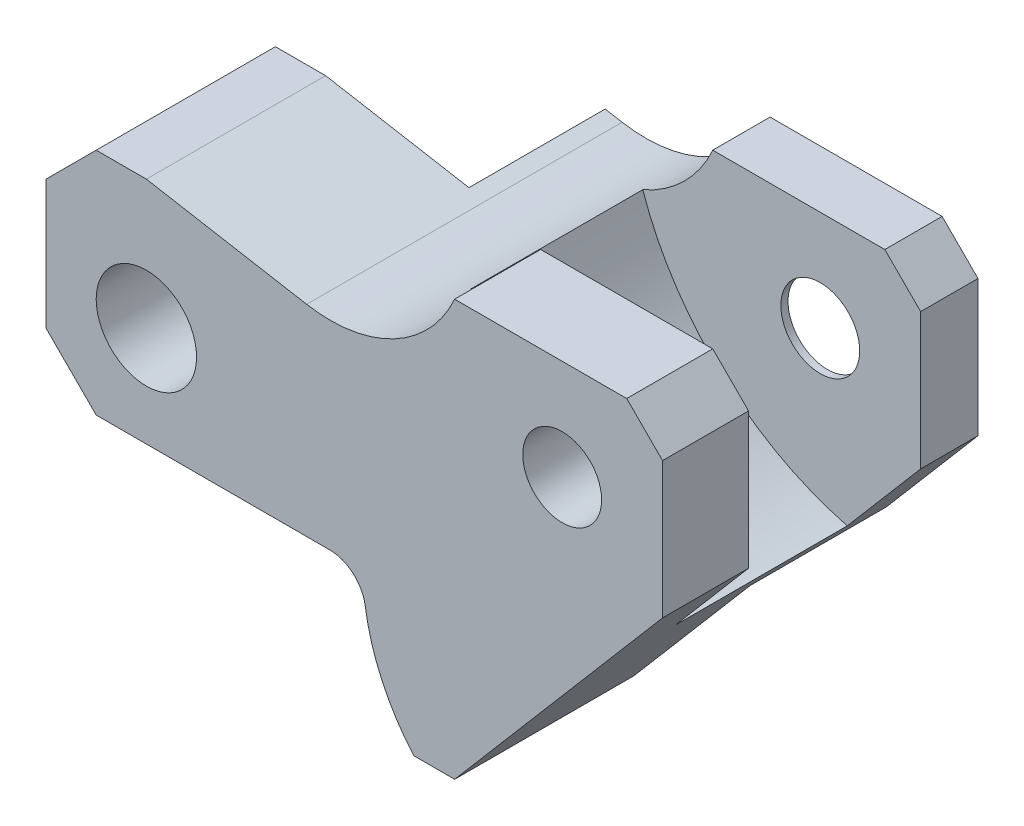
from build123d import *

# Parameters (mm, degrees)
ESQUISSE1_R             = 7
ESQUISSE1_R_2           = 5.5
BOSS_EXTRU_1_DEPTH      = 44
ENL_V_MAT_EXTRU_1_DEPTH = 19
ENL_V_MAT_EXTRU_2_DEPTH = 24
SHELL2_DEPTH            = 19
SHELL2_2_OUTLINE_R      = 6.5
SHELL2_2_DEPTH          = 7
SKETCH2_R               = 6.5
CUT_EXTRUDE1_DEPTH      = 7
CUT_EXTRUDE2_DEPTH      = 13


# Read off the part's stored shape, not the designer's step: Shell2
with BuildPart() as part:
    # Esquisse1 → Boss.-Extru.1 (new body)
    with BuildSketch(Plane.XY):
        with BuildLine():
            Line((-3.424461089, -10), (-36, -10))
            Line((-36, -10), (-43, -3))
            Line((-43, -3), (-43, 15))
            Line((-43, 15), (-36, 22))
            Line((-36, 22), (-29, 22))
            Line((-29, 22), (-6.638619164, 18.057085233))
            ThreePointArc((-6.638619164, 18.057085233), (5.561098706, 19.982044142), (14, 29))
            Line((14, 29), (38, 29))
            Line((38, 29), (43, 24))
            Line((43, 24), (43, 5))
            Line((43, 5), (14, -29))
            Line((14, -29), (8.296980053, -29))
            ThreePointArc((8.296980053, -29), (3.858007856, -22.115672061), (1.521177653, -14.264705882))
            ThreePointArc((1.521177653, -14.264705882), (-0.159225308, -11.213413768), (-3.424461089, -10))
        make_face()
        with Locations((-29, 4)):
            Circle(ESQUISSE1_R, mode=Mode.SUBTRACT)
        with Locations((29, 15)):
            Circle(ESQUISSE1_R_2, mode=Mode.SUBTRACT)
    extrude(amount=BOSS_EXTRU_1_DEPTH)

    # Esquisse4 → Enlèv. mat.-Extru.1 (cut)
    with BuildSketch(Plane(origin=(0, 0, 0), x_dir=(-1, 0, 0), z_dir=(0, 0, -1))):
        Polygon((9, 18.473460386), (9, -10), (36, -10), (43, -3), (43, 15), (36, 22), (29, 22), align=None)
        with BuildLine():
            Line((3.424461089, -10), (-30.205882353, -10))
            Line((-30.205882353, -10), (-14, -29))
            Line((-14, -29), (-8.296980053, -29))
            ThreePointArc((-8.296980053, -29), (-3.858007856, -22.115672061), (-1.521177653, -14.264705882))
            ThreePointArc((-1.521177653, -14.264705882), (0.159225308, -11.213413768), (3.424461089, -10))
        make_face()
    extrude(amount=-ENL_V_MAT_EXTRU_1_DEPTH, mode=Mode.SUBTRACT)

    # Esquisse5 → Enlèv. mat.-Extru.2 (cut)
    with BuildSketch(Plane.XY.offset(32)):
        with BuildLine():
            Line((2.167462324, 29), (38, 29))
            Line((38, 29), (43, 24))
            Line((43, 24), (43, 5))
            Line((43, 5), (32.764705882, -7))
            ThreePointArc((32.764705882, -7), (11.75930761, 6.149676936), (2.167462324, 29))
        make_face()
    extrude(amount=-ENL_V_MAT_EXTRU_2_DEPTH, mode=Mode.SUBTRACT)

    # Shell2 outline → Shell2 (cut)
    with BuildSketch(Plane.XY):
        with BuildLine():
            Line((-8, -9), (29.744476296, -9))
            Line((29.744476296, -9), (30.986847747, -7.543426575))
            ThreePointArc((30.986847747, -7.543426575), (14.310181683, 2.027872638), (3.646682943, 18.028208705))
            ThreePointArc((3.646682943, 18.028208705), (-1.518923584, 16.851449437), (-6.812267342, 17.07227748))
            Line((-6.812267342, 17.07227748), (-8, 17.281706793))
            Line((-8, 17.281706793), (-8, -9))
        make_face()
    extrude(amount=SHELL2_DEPTH, mode=Mode.SUBTRACT)

    # Shell2 2 outline → Shell2 2 (cut)
    with BuildSketch(Plane.XY):
        with BuildLine():
            ThreePointArc((3.646682943, 18.028208705), (14.310181683, 2.027872638), (30.986847747, -7.543426575))
            Line((30.986847747, -7.543426575), (42, 5.368545033))
            Line((42, 5.368545033), (42, 23.585786438))
            Line((42, 23.585786438), (37.585786438, 28))
            Line((37.585786438, 28), (14.636084685, 28))
            ThreePointArc((14.636084685, 28), (10.100440199, 21.957177308), (3.646682943, 18.028208705))
        make_face()
        with Locations((29, 15)):
            Circle(SHELL2_2_OUTLINE_R, mode=Mode.SUBTRACT)
    extrude(amount=SHELL2_2_DEPTH, mode=Mode.SUBTRACT)

    # Sketch2 → Cut-Extrude1 (cut)
    with BuildSketch(Plane(origin=(0, 0, 0), x_dir=(-1, 0, 0), z_dir=(0, 0, -1))):
        with Locations((-29, 15)):
            Circle(SKETCH2_R)
    extrude(amount=-CUT_EXTRUDE1_DEPTH, mode=Mode.SUBTRACT)

    # Sketch3 → Cut-Extrude2 (cut)
    with BuildSketch(Plane(origin=(0, 0, 19), x_dir=(-1, 0, 0), z_dir=(0, 0, -1))):
        with BuildLine():
            Line((-29.744476296, -9), (8, -9))
            Line((8, -9), (8, 17.281706793))
            Line((8, 17.281706793), (6.812267342, 17.07227748))
            ThreePointArc((6.812267342, 17.07227748), (1.518923584, 16.851449437), (-3.646682943, 18.028208705))
            ThreePointArc((-3.646682943, 18.028208705), (-14.310181683, 2.027872638), (-30.986847747, -7.543426575))
            Line((-30.986847747, -7.543426575), (-29.744476296, -9))
        make_face()
    extrude(amount=-CUT_EXTRUDE2_DEPTH, mode=Mode.SUBTRACT)


solid = part.part
